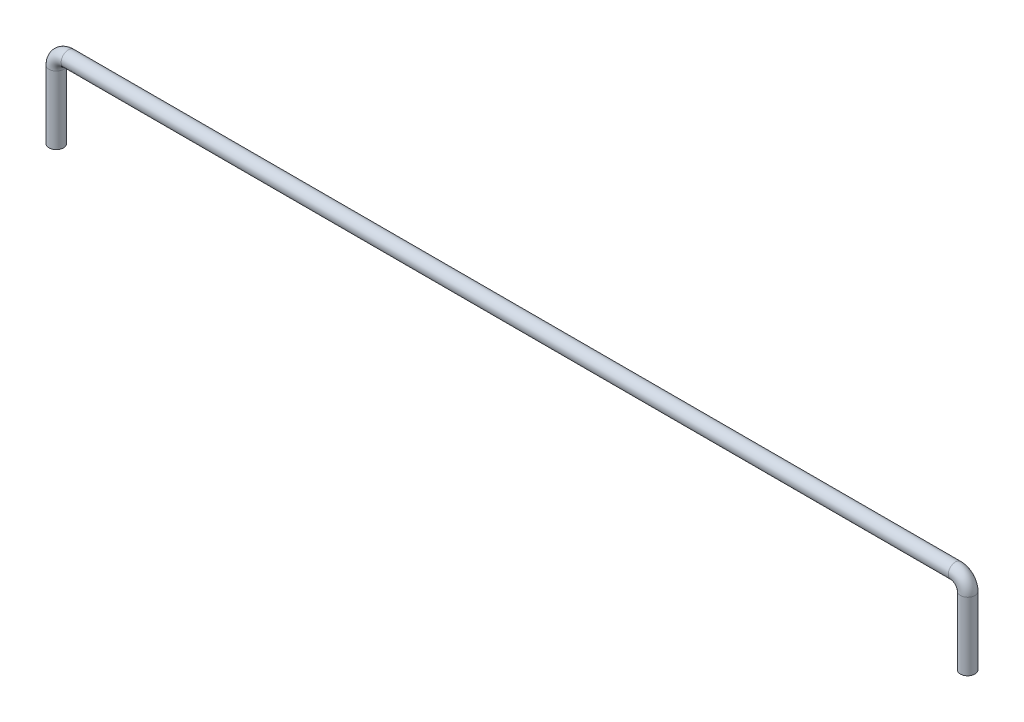
from build123d import *

# Parameters (mm, degrees)
SKETCH1_R           = 0.3
BOSS_EXTRUDE1_DEPTH = 2
SWEEP1_OUTLINE_R    = 0.3
SWEEP1_DEPTH        = 2.8
SWEEP1_2_OUTLINE_R  = 0.3
SWEEP1_2_ANGLE      = 90
SWEEP1_3_OUTLINE_R  = 0.3
SWEEP1_3_ANGLE      = 90
SWEEP1_START        = 0.4999999
SWEEP1_4_OUTLINE_R  = 0.3
SWEEP1_4_DEPTH      = 36.5000002


with BuildPart() as part:
    # Sketch1 → Boss-Extrude1 (new body)
    with BuildSketch(Plane(origin=(0, 0, 0), x_dir=(1, 0, 0), z_dir=(0, 1, 0))):
        with Locations(Location((0, 0, 0), (0, 0, 270))):
            Circle(SKETCH1_R)
    extrude(amount=BOSS_EXTRUDE1_DEPTH)

    # Sweep1: read off the stored shape, not the designer's step
    # Sweep1 outline → Sweep1 (add)
    with BuildSketch(Plane(origin=(0, 0, 0), x_dir=(1, 0, 0), z_dir=(0, 1, 0))):
        Circle(SWEEP1_OUTLINE_R)
        with Locations((37.5, 0)):
            Circle(SWEEP1_OUTLINE_R)
    extrude(amount=SWEEP1_DEPTH)

    # Sweep1 2 outline → Sweep1 2 (revolve)
    with BuildSketch(Plane(origin=(0.5, 2.8, 0), x_dir=(0, 1, 0), z_dir=(1, 0, 0))):
        with Locations((0.5, 0)):
            Circle(SWEEP1_2_OUTLINE_R)
    revolve(axis=Axis((0.5, 2.8, 0), (0, 0, 1)), revolution_arc=SWEEP1_2_ANGLE)

    # Sweep1 3 outline → Sweep1 3 (revolve)
    with BuildSketch(Plane(origin=(37, 2.8, 0), x_dir=(1, 0, 0), z_dir=(0, -1, 0))):
        with Locations((0.5, 0)):
            Circle(SWEEP1_3_OUTLINE_R)
    revolve(axis=Axis((37, 2.8, 0), (0, 0, 1)), revolution_arc=SWEEP1_3_ANGLE)

    # Sweep1 4 outline → Sweep1 4 (add)
    with BuildSketch(Plane.YZ.offset(SWEEP1_START)):
        with Locations((3.3, 0)):
            Circle(SWEEP1_4_OUTLINE_R)
    extrude(amount=SWEEP1_4_DEPTH)


solid = part.part
